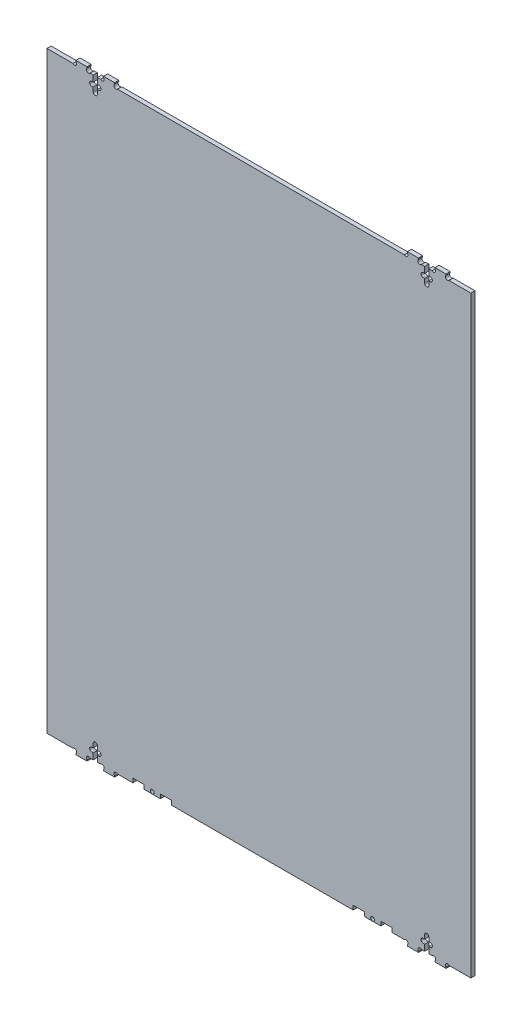
from build123d import *

# Parameters (mm, degrees)
SKETCH_1_W                      = 620.3
SKETCH_1_H                      = 871.6
EXTRUDE_1_DEPTH                 = 6
CUT_EXTRUDE_5_DEPTH             = 1219.886594397
CUT_EXTRUDE_5_DEPTH_BACK        = 1219.886594397
SKETCH_5_R                      = 2.75
SKETCH_5_W                      = 424.3
SKETCH_5_H                      = 6
SKETCH_5_W_2                    = 42.1
CUT_EXTRUDE_6_01_DEPTH          = 1219.886594397
CUT_EXTRUDE_6_01_DEPTH_BACK     = 1219.886594397
SKETCH_6_01_W                   = 6
SKETCH_6_01_H                   = 21.2
CUT_EXTRUDE_6_01_2_DEPTH        = 1219.886594397
CUT_EXTRUDE_6_01_2_DEPTH_BACK   = 1219.886594397
SKETCH_6_01_2_W                 = 10.3
SKETCH_6_01_2_H                 = 6.2
CUT_EXTRUDE_6_01_1_DEPTH        = 1219.886594397
CUT_EXTRUDE_6_01_1_DEPTH_BACK   = 1219.886594397
SKETCH_6_01_1_R                 = 3.05
CUT_EXTRUDE_6_01_1_2_DEPTH      = 1219.886594397
CUT_EXTRUDE_6_01_1_2_DEPTH_BACK = 1219.886594397
SKETCH_6_01_1_2_R               = 3.05
CUT_EXTRUDE_6_01_3_DEPTH        = 1219.886594397
CUT_EXTRUDE_6_01_3_DEPTH_BACK   = 1219.886594397
SKETCH_6_01_3_R                 = 3
CUT_EXTRUDE_6_02_DEPTH          = 1219.886594397
CUT_EXTRUDE_6_02_DEPTH_BACK     = 1219.886594397
SKETCH_6_02_W                   = 6
SKETCH_6_02_H                   = 21.2
CUT_EXTRUDE_6_02_2_DEPTH        = 1219.886594397
CUT_EXTRUDE_6_02_2_DEPTH_BACK   = 1219.886594397
SKETCH_6_02_2_W                 = 10.3
SKETCH_6_02_2_H                 = 6.2
CUT_EXTRUDE_6_02_1_DEPTH        = 1219.886594397
CUT_EXTRUDE_6_02_1_DEPTH_BACK   = 1219.886594397
SKETCH_6_02_1_R                 = 3.05
CUT_EXTRUDE_6_02_1_2_DEPTH      = 1219.886594397
CUT_EXTRUDE_6_02_1_2_DEPTH_BACK = 1219.886594397
SKETCH_6_02_1_2_R               = 3.05
CUT_EXTRUDE_6_02_3_DEPTH        = 1219.886594397
CUT_EXTRUDE_6_02_3_DEPTH_BACK   = 1219.886594397
SKETCH_6_02_3_R                 = 3
CUT_EXTRUDE_6_03_DEPTH          = 1219.886594397
CUT_EXTRUDE_6_03_DEPTH_BACK     = 1219.886594397
SKETCH_6_03_W                   = 6
SKETCH_6_03_H                   = 21.2
CUT_EXTRUDE_6_03_2_DEPTH        = 1219.886594397
CUT_EXTRUDE_6_03_2_DEPTH_BACK   = 1219.886594397
SKETCH_6_03_2_W                 = 10.3
SKETCH_6_03_2_H                 = 6.2
CUT_EXTRUDE_6_03_1_DEPTH        = 1219.886594397
CUT_EXTRUDE_6_03_1_DEPTH_BACK   = 1219.886594397
SKETCH_6_03_1_R                 = 3.05
CUT_EXTRUDE_6_03_1_2_DEPTH      = 1219.886594397
CUT_EXTRUDE_6_03_1_2_DEPTH_BACK = 1219.886594397
SKETCH_6_03_1_2_R               = 3.05
CUT_EXTRUDE_6_03_3_DEPTH        = 1219.886594397
CUT_EXTRUDE_6_03_3_DEPTH_BACK   = 1219.886594397
SKETCH_6_03_3_R                 = 3
CUT_EXTRUDE_6_04_DEPTH          = 1219.886594397
CUT_EXTRUDE_6_04_DEPTH_BACK     = 1219.886594397
SKETCH_6_04_W                   = 6
SKETCH_6_04_H                   = 21.2
CUT_EXTRUDE_6_04_2_DEPTH        = 1219.886594397
CUT_EXTRUDE_6_04_2_DEPTH_BACK   = 1219.886594397
SKETCH_6_04_2_W                 = 10.3
SKETCH_6_04_2_H                 = 6.2
CUT_EXTRUDE_6_04_1_DEPTH        = 1219.886594397
CUT_EXTRUDE_6_04_1_DEPTH_BACK   = 1219.886594397
SKETCH_6_04_1_R                 = 3.05
CUT_EXTRUDE_6_04_1_2_DEPTH      = 1219.886594397
CUT_EXTRUDE_6_04_1_2_DEPTH_BACK = 1219.886594397
SKETCH_6_04_1_2_R               = 3.05
CUT_EXTRUDE_6_04_3_DEPTH        = 1219.886594397
CUT_EXTRUDE_6_04_3_DEPTH_BACK   = 1219.886594397
SKETCH_6_04_3_R                 = 3
CUT_EXTRUDE_01_DEPTH            = 1219.886594397
CUT_EXTRUDE_01_DEPTH_BACK       = 1219.886594397
SKETCH_01_R                     = 3.05
CUT_EXTRUDE_02_DEPTH            = 1219.886594397
CUT_EXTRUDE_02_DEPTH_BACK       = 1219.886594397
SKETCH_02_R                     = 3.05
CUT_EXTRUDE_03_DEPTH            = 1219.886594397
CUT_EXTRUDE_03_DEPTH_BACK       = 1219.886594397
SKETCH_03_R                     = 3.05
CUT_EXTRUDE_04_DEPTH            = 1219.886594397
CUT_EXTRUDE_04_DEPTH_BACK       = 1219.886594397
SKETCH_04_R                     = 3.05


with BuildPart() as part:
    # Эскиз1 → Бобышка-Вытянуть1 (new body)
    with BuildSketch(Plane.XY):
        with Locations((-828.15, 0)):
            Rectangle(SKETCH_1_W, SKETCH_1_H)
    extrude(amount=-EXTRUDE_1_DEPTH)

    # Стыки_эскиз_пазов_и_стяжек_М5 → Стыки_шип_паз_стяжки_М5 (cut, two sides: drawn at the far end of the back side and taken through both)
    with BuildSketch(Plane.XY.offset(-CUT_EXTRUDE_5_DEPTH_BACK)):
        with Locations((-985.8, -426.8)):
            Circle(SKETCH_5_R)
        with Locations((-666.5, -426.8)):
            Circle(SKETCH_5_R)
        Polygon((-973.875, -429.8), (-997.725, -429.8), (-997.725, -423.725), (-1013.875, -423.725), (-1013.875, -429.8), (-1040.3, -429.8), (-1040.3, -435.8), (-616, -435.8), (-616, -429.8), (-638.425, -429.8), (-638.425, -423.725), (-654.575, -423.725), (-654.575, -429.8), (-678.425, -429.8), (-678.425, -423.725), (-694.575, -423.725), (-694.575, -429.8), (-957.725, -429.8), (-957.725, -423.725), (-973.875, -423.725), align=None)
        Polygon((-524, -429.8), (-560, -429.8), (-560, -435.8), (-517.9, -435.8), (-517.9, -429.8), (-518, -429.8), (-518, 429.8), (-517.9, 429.8), (-517.9, 435.8), (-560, 435.8), (-560, 429.8), (-524, 429.8), align=None)
        Polygon((-1080.3, 435.8), (-1080.3, 429.8), (-1071.05, 429.8), (-1071.05, 419.95), (-1072.45, 419.95), (-1072.45, 415.65), (-1071.05, 415.65), (-1071.05, 408.8), (-1065.55, 408.8), (-1065.55, 415.65), (-1064.15, 415.65), (-1064.15, 419.95), (-1065.55, 419.95), (-1065.55, 429.8), (-1056.3, 429.8), (-1056.3, 435.8), (-1065.55, 435.8), (-1065.55, 435.9), (-1071.05, 435.9), (-1071.05, 435.8), align=None)
        Polygon((-585.25, 429.8), (-576, 429.8), (-576, 435.8), (-585.25, 435.8), (-585.25, 435.9), (-590.75, 435.9), (-590.75, 435.8), (-600, 435.8), (-600, 429.8), (-590.75, 429.8), (-590.75, 419.95), (-592.15, 419.95), (-592.15, 415.65), (-590.75, 415.65), (-590.75, 408.8), (-585.25, 408.8), (-585.25, 415.65), (-583.85, 415.65), (-583.85, 419.95), (-585.25, 419.95), align=None)
        Polygon((-600, -435.8), (-590.75, -435.8), (-590.75, -435.9), (-585.25, -435.9), (-585.25, -435.8), (-576, -435.8), (-576, -429.8), (-585.25, -429.8), (-585.25, -419.95), (-583.85, -419.95), (-583.85, -415.65), (-585.25, -415.65), (-585.25, -408.8), (-590.75, -408.8), (-590.75, -415.65), (-592.15, -415.65), (-592.15, -419.95), (-590.75, -419.95), (-590.75, -429.8), (-600, -429.8), align=None)
        Polygon((-1065.55, -419.95), (-1064.15, -419.95), (-1064.15, -415.65), (-1065.55, -415.65), (-1065.55, -408.8), (-1071.05, -408.8), (-1071.05, -415.65), (-1072.45, -415.65), (-1072.45, -419.95), (-1071.05, -419.95), (-1071.05, -429.8), (-1080.3, -429.8), (-1080.3, -435.8), (-1071.05, -435.8), (-1071.05, -435.9), (-1065.55, -435.9), (-1065.55, -435.8), (-1056.3, -435.8), (-1056.3, -429.8), (-1065.55, -429.8), align=None)
        with Locations((-828.15, 432.8)):
            Rectangle(SKETCH_5_W, SKETCH_5_H)
        with Locations((-1117.35, 432.8)):
            Rectangle(SKETCH_5_W_2, SKETCH_5_H)
        with Locations((-1117.35, -432.8)):
            Rectangle(SKETCH_5_W_2, SKETCH_5_H)
    extrude(amount=CUT_EXTRUDE_5_DEPTH + CUT_EXTRUDE_5_DEPTH_BACK, mode=Mode.SUBTRACT)

    # Sketch 6_01 → Cut-Extrude 6_01 (cut, two sides: drawn at the far end of the back side and taken through both)
    with BuildSketch(Plane.XY.offset(-CUT_EXTRUDE_6_01_DEPTH_BACK)):
        with Locations((-1068.3, 419.3)):
            Rectangle(SKETCH_6_01_W, SKETCH_6_01_H)
    extrude(amount=CUT_EXTRUDE_6_01_DEPTH + CUT_EXTRUDE_6_01_DEPTH_BACK, mode=Mode.SUBTRACT)

    # Sketch 6_01 2 → Cut-Extrude 6_01 2 (cut, two sides: drawn at the far end of the back side and taken through both)
    with BuildSketch(Plane.XY.offset(-CUT_EXTRUDE_6_01_2_DEPTH_BACK)):
        with Locations((-1068.3, 417.8)):
            Rectangle(SKETCH_6_01_2_W, SKETCH_6_01_2_H)
    extrude(amount=CUT_EXTRUDE_6_01_2_DEPTH + CUT_EXTRUDE_6_01_2_DEPTH_BACK, mode=Mode.SUBTRACT)

    # Sketch 6_01_____1 → Cut-Extrude 6_01_____1 (cut, two sides: drawn at the far end of the back side and taken through both)
    with BuildSketch(Plane.XY.offset(-CUT_EXTRUDE_6_01_1_DEPTH_BACK)):
        with Locations((-1063.15, 417.85)):
            Circle(SKETCH_6_01_1_R)
        with Locations((-1073.45, 417.85)):
            Circle(SKETCH_6_01_1_R)
    extrude(amount=CUT_EXTRUDE_6_01_1_DEPTH + CUT_EXTRUDE_6_01_1_DEPTH_BACK, mode=Mode.SUBTRACT)

    # Sketch 6_01_____-1 2 → Cut-Extrude 6_01_____-1 2 (cut, two sides: drawn at the far end of the back side and taken through both)
    with BuildSketch(Plane.XY.offset(-CUT_EXTRUDE_6_01_1_2_DEPTH_BACK)):
        with Locations((-1063.15, 417.75)):
            Circle(SKETCH_6_01_1_2_R)
        with Locations((-1073.45, 417.75)):
            Circle(SKETCH_6_01_1_2_R)
    extrude(amount=CUT_EXTRUDE_6_01_1_2_DEPTH + CUT_EXTRUDE_6_01_1_2_DEPTH_BACK, mode=Mode.SUBTRACT)

    # Sketch 6_01 3 → Cut-Extrude 6_01 3 (cut, two sides: drawn at the far end of the back side and taken through both)
    with BuildSketch(Plane.XY.offset(-CUT_EXTRUDE_6_01_3_DEPTH_BACK)):
        with Locations((-1068.3, 408.7)):
            Circle(SKETCH_6_01_3_R)
    extrude(amount=CUT_EXTRUDE_6_01_3_DEPTH + CUT_EXTRUDE_6_01_3_DEPTH_BACK, mode=Mode.SUBTRACT)

    # Sketch 6_02 → Cut-Extrude 6_02 (cut, two sides: drawn at the far end of the back side and taken through both)
    with BuildSketch(Plane.XY.offset(-CUT_EXTRUDE_6_02_DEPTH_BACK)):
        with Locations((-588, 419.3)):
            Rectangle(SKETCH_6_02_W, SKETCH_6_02_H)
    extrude(amount=CUT_EXTRUDE_6_02_DEPTH + CUT_EXTRUDE_6_02_DEPTH_BACK, mode=Mode.SUBTRACT)

    # Sketch 6_02 2 → Cut-Extrude 6_02 2 (cut, two sides: drawn at the far end of the back side and taken through both)
    with BuildSketch(Plane.XY.offset(-CUT_EXTRUDE_6_02_2_DEPTH_BACK)):
        with Locations((-588, 417.8)):
            Rectangle(SKETCH_6_02_2_W, SKETCH_6_02_2_H)
    extrude(amount=CUT_EXTRUDE_6_02_2_DEPTH + CUT_EXTRUDE_6_02_2_DEPTH_BACK, mode=Mode.SUBTRACT)

    # Sketch 6_02_____1 → Cut-Extrude 6_02_____1 (cut, two sides: drawn at the far end of the back side and taken through both)
    with BuildSketch(Plane.XY.offset(-CUT_EXTRUDE_6_02_1_DEPTH_BACK)):
        with Locations((-582.85, 417.85)):
            Circle(SKETCH_6_02_1_R)
        with Locations((-593.15, 417.85)):
            Circle(SKETCH_6_02_1_R)
    extrude(amount=CUT_EXTRUDE_6_02_1_DEPTH + CUT_EXTRUDE_6_02_1_DEPTH_BACK, mode=Mode.SUBTRACT)

    # Sketch 6_02_____-1 2 → Cut-Extrude 6_02_____-1 2 (cut, two sides: drawn at the far end of the back side and taken through both)
    with BuildSketch(Plane.XY.offset(-CUT_EXTRUDE_6_02_1_2_DEPTH_BACK)):
        with Locations((-582.85, 417.75)):
            Circle(SKETCH_6_02_1_2_R)
        with Locations((-593.15, 417.75)):
            Circle(SKETCH_6_02_1_2_R)
    extrude(amount=CUT_EXTRUDE_6_02_1_2_DEPTH + CUT_EXTRUDE_6_02_1_2_DEPTH_BACK, mode=Mode.SUBTRACT)

    # Sketch 6_02 3 → Cut-Extrude 6_02 3 (cut, two sides: drawn at the far end of the back side and taken through both)
    with BuildSketch(Plane.XY.offset(-CUT_EXTRUDE_6_02_3_DEPTH_BACK)):
        with Locations((-588, 408.7)):
            Circle(SKETCH_6_02_3_R)
    extrude(amount=CUT_EXTRUDE_6_02_3_DEPTH + CUT_EXTRUDE_6_02_3_DEPTH_BACK, mode=Mode.SUBTRACT)

    # Sketch 6_03 → Cut-Extrude 6_03 (cut, two sides: drawn at the far end of the back side and taken through both)
    with BuildSketch(Plane.XY.offset(-CUT_EXTRUDE_6_03_DEPTH_BACK)):
        with Locations((-588, -419.3)):
            Rectangle(SKETCH_6_03_W, SKETCH_6_03_H)
    extrude(amount=CUT_EXTRUDE_6_03_DEPTH + CUT_EXTRUDE_6_03_DEPTH_BACK, mode=Mode.SUBTRACT)

    # Sketch 6_03 2 → Cut-Extrude 6_03 2 (cut, two sides: drawn at the far end of the back side and taken through both)
    with BuildSketch(Plane.XY.offset(-CUT_EXTRUDE_6_03_2_DEPTH_BACK)):
        with Locations((-588, -417.8)):
            Rectangle(SKETCH_6_03_2_W, SKETCH_6_03_2_H)
    extrude(amount=CUT_EXTRUDE_6_03_2_DEPTH + CUT_EXTRUDE_6_03_2_DEPTH_BACK, mode=Mode.SUBTRACT)

    # Sketch 6_03_____1 → Cut-Extrude 6_03_____1 (cut, two sides: drawn at the far end of the back side and taken through both)
    with BuildSketch(Plane.XY.offset(-CUT_EXTRUDE_6_03_1_DEPTH_BACK)):
        with Locations((-582.85, -417.75)):
            Circle(SKETCH_6_03_1_R)
        with Locations((-593.15, -417.75)):
            Circle(SKETCH_6_03_1_R)
    extrude(amount=CUT_EXTRUDE_6_03_1_DEPTH + CUT_EXTRUDE_6_03_1_DEPTH_BACK, mode=Mode.SUBTRACT)

    # Sketch 6_03_____-1 2 → Cut-Extrude 6_03_____-1 2 (cut, two sides: drawn at the far end of the back side and taken through both)
    with BuildSketch(Plane.XY.offset(-CUT_EXTRUDE_6_03_1_2_DEPTH_BACK)):
        with Locations((-582.85, -417.85)):
            Circle(SKETCH_6_03_1_2_R)
        with Locations((-593.15, -417.85)):
            Circle(SKETCH_6_03_1_2_R)
    extrude(amount=CUT_EXTRUDE_6_03_1_2_DEPTH + CUT_EXTRUDE_6_03_1_2_DEPTH_BACK, mode=Mode.SUBTRACT)

    # Sketch 6_03 3 → Cut-Extrude 6_03 3 (cut, two sides: drawn at the far end of the back side and taken through both)
    with BuildSketch(Plane.XY.offset(-CUT_EXTRUDE_6_03_3_DEPTH_BACK)):
        with Locations((-588, -408.7)):
            Circle(SKETCH_6_03_3_R)
    extrude(amount=CUT_EXTRUDE_6_03_3_DEPTH + CUT_EXTRUDE_6_03_3_DEPTH_BACK, mode=Mode.SUBTRACT)

    # Sketch 6_04 → Cut-Extrude 6_04 (cut, two sides: drawn at the far end of the back side and taken through both)
    with BuildSketch(Plane.XY.offset(-CUT_EXTRUDE_6_04_DEPTH_BACK)):
        with Locations((-1068.3, -419.3)):
            Rectangle(SKETCH_6_04_W, SKETCH_6_04_H)
    extrude(amount=CUT_EXTRUDE_6_04_DEPTH + CUT_EXTRUDE_6_04_DEPTH_BACK, mode=Mode.SUBTRACT)

    # Sketch 6_04 2 → Cut-Extrude 6_04 2 (cut, two sides: drawn at the far end of the back side and taken through both)
    with BuildSketch(Plane.XY.offset(-CUT_EXTRUDE_6_04_2_DEPTH_BACK)):
        with Locations((-1068.3, -417.8)):
            Rectangle(SKETCH_6_04_2_W, SKETCH_6_04_2_H)
    extrude(amount=CUT_EXTRUDE_6_04_2_DEPTH + CUT_EXTRUDE_6_04_2_DEPTH_BACK, mode=Mode.SUBTRACT)

    # Sketch 6_04_____1 → Cut-Extrude 6_04_____1 (cut, two sides: drawn at the far end of the back side and taken through both)
    with BuildSketch(Plane.XY.offset(-CUT_EXTRUDE_6_04_1_DEPTH_BACK)):
        with Locations((-1063.15, -417.75)):
            Circle(SKETCH_6_04_1_R)
        with Locations((-1073.45, -417.75)):
            Circle(SKETCH_6_04_1_R)
    extrude(amount=CUT_EXTRUDE_6_04_1_DEPTH + CUT_EXTRUDE_6_04_1_DEPTH_BACK, mode=Mode.SUBTRACT)

    # Sketch 6_04_____-1 2 → Cut-Extrude 6_04_____-1 2 (cut, two sides: drawn at the far end of the back side and taken through both)
    with BuildSketch(Plane.XY.offset(-CUT_EXTRUDE_6_04_1_2_DEPTH_BACK)):
        with Locations((-1063.15, -417.85)):
            Circle(SKETCH_6_04_1_2_R)
        with Locations((-1073.45, -417.85)):
            Circle(SKETCH_6_04_1_2_R)
    extrude(amount=CUT_EXTRUDE_6_04_1_2_DEPTH + CUT_EXTRUDE_6_04_1_2_DEPTH_BACK, mode=Mode.SUBTRACT)

    # Sketch 6_04 3 → Cut-Extrude 6_04 3 (cut, two sides: drawn at the far end of the back side and taken through both)
    with BuildSketch(Plane.XY.offset(-CUT_EXTRUDE_6_04_3_DEPTH_BACK)):
        with Locations((-1068.3, -408.7)):
            Circle(SKETCH_6_04_3_R)
    extrude(amount=CUT_EXTRUDE_6_04_3_DEPTH + CUT_EXTRUDE_6_04_3_DEPTH_BACK, mode=Mode.SUBTRACT)

    # ЧПУ_Шаблон_углов_01 → ЧПУ_Разгрузки_01 (cut, two sides: drawn at the far end of the back side and taken through both)
    with BuildSketch(Plane.XY.offset(-CUT_EXTRUDE_01_DEPTH_BACK)):
        with Locations((-1098.421320344, 431.921320344)):
            Circle(SKETCH_01_R)
        with Locations((-1058.421320344, 431.921320344)):
            Circle(SKETCH_01_R)
        with Locations((-618.121320344, 431.921320344)):
            Circle(SKETCH_01_R)
        with Locations((-578.121320344, 431.921320344)):
            Circle(SKETCH_01_R)
    extrude(amount=CUT_EXTRUDE_01_DEPTH + CUT_EXTRUDE_01_DEPTH_BACK, mode=Mode.SUBTRACT)

    # ЧПУ_Шаблон_углов_02 → ЧПУ_Разгрузки_02 (cut, two sides: drawn at the far end of the back side and taken through both)
    with BuildSketch(Plane.XY.offset(-CUT_EXTRUDE_02_DEPTH_BACK)):
        with Locations((-1078.178679656, 431.921320344)):
            Circle(SKETCH_02_R)
        with Locations((-1038.178679656, 431.921320344)):
            Circle(SKETCH_02_R)
        with Locations((-597.878679656, 431.921320344)):
            Circle(SKETCH_02_R)
        with Locations((-557.878679656, 431.921320344)):
            Circle(SKETCH_02_R)
    extrude(amount=CUT_EXTRUDE_02_DEPTH + CUT_EXTRUDE_02_DEPTH_BACK, mode=Mode.SUBTRACT)

    # ЧПУ_Шаблон_углов_03 → ЧПУ_Разгрузки_03 (cut, two sides: drawn at the far end of the back side and taken through both)
    with BuildSketch(Plane.XY.offset(-CUT_EXTRUDE_03_DEPTH_BACK)):
        with Locations((-557.878679656, -431.921320344)):
            Circle(SKETCH_03_R)
        with Locations((-597.878679656, -431.921320344)):
            Circle(SKETCH_03_R)
        with Locations((-1038.178679656, -431.921320344)):
            Circle(SKETCH_03_R)
        with Locations((-1078.178679656, -431.921320344)):
            Circle(SKETCH_03_R)
    extrude(amount=CUT_EXTRUDE_03_DEPTH + CUT_EXTRUDE_03_DEPTH_BACK, mode=Mode.SUBTRACT)

    # ЧПУ_Шаблон_углов_04 → ЧПУ_Разгрузки_04 (cut, two sides: drawn at the far end of the back side and taken through both)
    with BuildSketch(Plane.XY.offset(-CUT_EXTRUDE_04_DEPTH_BACK)):
        with Locations((-578.121320344, -431.921320344)):
            Circle(SKETCH_04_R)
        with Locations((-618.121320344, -431.921320344)):
            Circle(SKETCH_04_R)
        with Locations((-1058.421320344, -431.921320344)):
            Circle(SKETCH_04_R)
        with Locations((-1098.421320344, -431.921320344)):
            Circle(SKETCH_04_R)
    extrude(amount=CUT_EXTRUDE_04_DEPTH + CUT_EXTRUDE_04_DEPTH_BACK, mode=Mode.SUBTRACT)


solid = part.part
